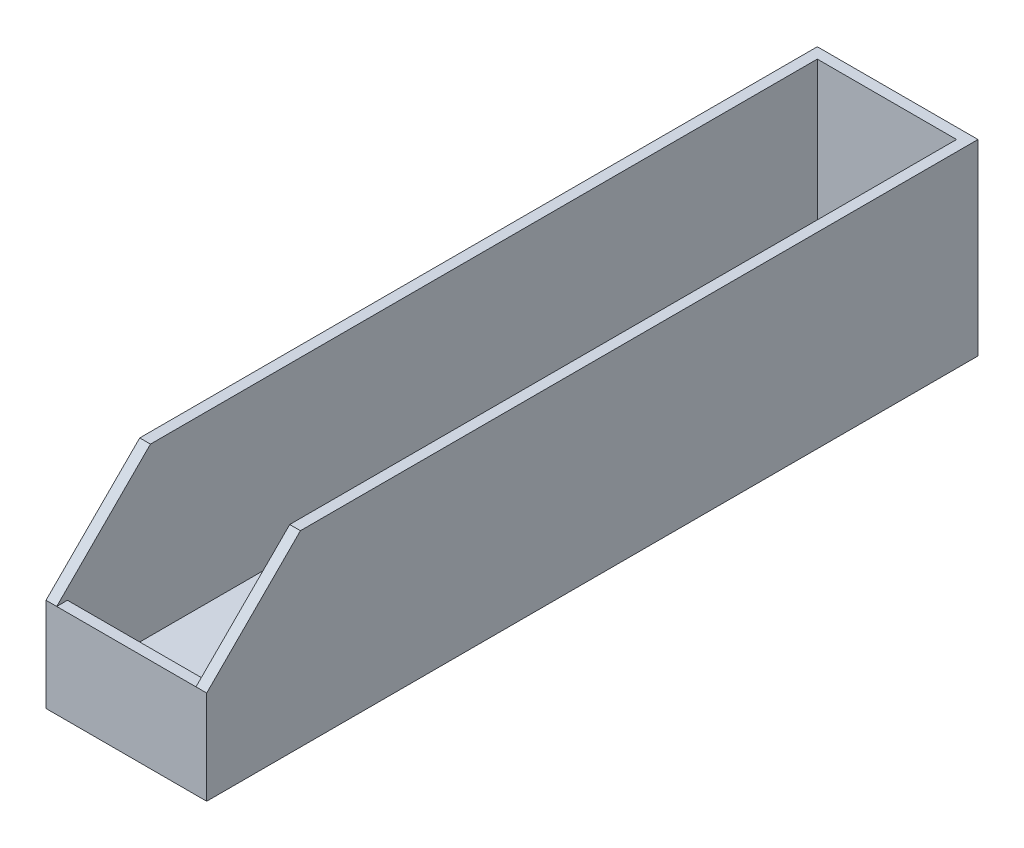
from build123d import *

# Parameters (mm, degrees)
SKETCH1_W           = 26
SKETCH1_H           = 140
BOSS_EXTRUDE1_DEPTH = 4
BOSS_EXTRUDE2_DEPTH = 35
SKETCH1_5_W         = 26
SKETCH1_5_H         = 2
BOSS_EXTRUDE3_DEPTH = 17.5
CUT_EXTRUDE1_REACH  = 81.812
SKETCH2_R           = 1.7
SKETCH2_3_R         = 2.5
SKETCH2_3_R_2       = 1.7
CUT_EXTRUDE2_DEPTH  = 2
CUT_EXTRUDE3_DEPTH  = 86.492689746


with BuildPart() as part:
    # Sketch1 → Boss-Extrude1 (new body)
    with BuildSketch(Plane(origin=(0, 0, 0), x_dir=(1, 0, 0), z_dir=(0, 1, 0))):
        Rectangle(SKETCH1_W, SKETCH1_H)
    extrude(amount=BOSS_EXTRUDE1_DEPTH)

    # Sketch1<4> → Boss-Extrude2 (add)
    with BuildSketch(Plane(origin=(0, 0, 0), x_dir=(1, 0, 0), z_dir=(0, 1, 0))):
        Polygon((-13, -72), (-13, -70), (-13, 70), (13, 70), (13, -70), (13, -72), (15, -72), (15, 72), (-15, 72), (-15, -72), align=None)
    extrude(amount=BOSS_EXTRUDE2_DEPTH)

    # Sketch1<5> → Boss-Extrude3 (add)
    with BuildSketch(Plane(origin=(0, 0, 0), x_dir=(1, 0, 0), z_dir=(0, 1, 0))):
        with Locations((0, -71)):
            Rectangle(SKETCH1_5_W, SKETCH1_5_H)
    extrude(amount=BOSS_EXTRUDE3_DEPTH)

    # Sketch2 → Cut-Extrude1 (cut, up to next)
    with BuildSketch(Plane(origin=(0, 4, 0), x_dir=(1, 0, 0), z_dir=(0, 1, 0)), mode=Mode.PRIVATE) as cut_extrude1_sk1:
        with Locations((0, 30)):
            Circle(SKETCH2_R)
    cut_extrude1_tool1 = extrude(cut_extrude1_sk1.sketch, amount=-CUT_EXTRUDE1_REACH, mode=Mode.PRIVATE) & part.part
    # Sketch2 → Cut-Extrude1 (cut, up to next)
    with BuildSketch(Plane(origin=(0, 4, 0), x_dir=(1, 0, 0), z_dir=(0, 1, 0)), mode=Mode.PRIVATE) as cut_extrude1_sk2:
        with Locations((0, -30)):
            Circle(SKETCH2_R)
    cut_extrude1_tool2 = extrude(cut_extrude1_sk2.sketch, amount=-CUT_EXTRUDE1_REACH, mode=Mode.PRIVATE) & part.part
    add(cut_extrude1_tool1.solids().sort_by_distance((0, 4, -30))[0], mode=Mode.SUBTRACT)
    add(cut_extrude1_tool2.solids().sort_by_distance((0, 4, 30))[0], mode=Mode.SUBTRACT)

    # Sketch2<3> → Cut-Extrude2 (cut)
    # profile 1 of 2: a face of its own
    with BuildSketch(Plane(origin=(0, 4, 0), x_dir=(1, 0, 0), z_dir=(0, 1, 0))):
        with Locations((0, 30)):
            Circle(SKETCH2_3_R)
        with Locations((0, 30)):
            Circle(SKETCH2_3_R_2, mode=Mode.SUBTRACT)
    # profile 2 of 2: a face of its own
    with BuildSketch(Plane(origin=(0, 4, 0), x_dir=(1, 0, 0), z_dir=(0, 1, 0))):
        with Locations((0, -30)):
            Circle(SKETCH2_3_R)
        with Locations((0, -30)):
            Circle(SKETCH2_3_R_2, mode=Mode.SUBTRACT)
    extrude(amount=-CUT_EXTRUDE2_DEPTH, mode=Mode.SUBTRACT)

    # Sketch3 → Cut-Extrude3 (cut, through all)
    with BuildSketch(Plane(origin=(15, 0, 0), x_dir=(0, 0, -1), z_dir=(1, 0, 0))):
        Polygon((-72, 17.5), (-54.5, 35), (-72, 35), align=None)
    extrude(amount=-CUT_EXTRUDE3_DEPTH, mode=Mode.SUBTRACT)


solid = part.part
